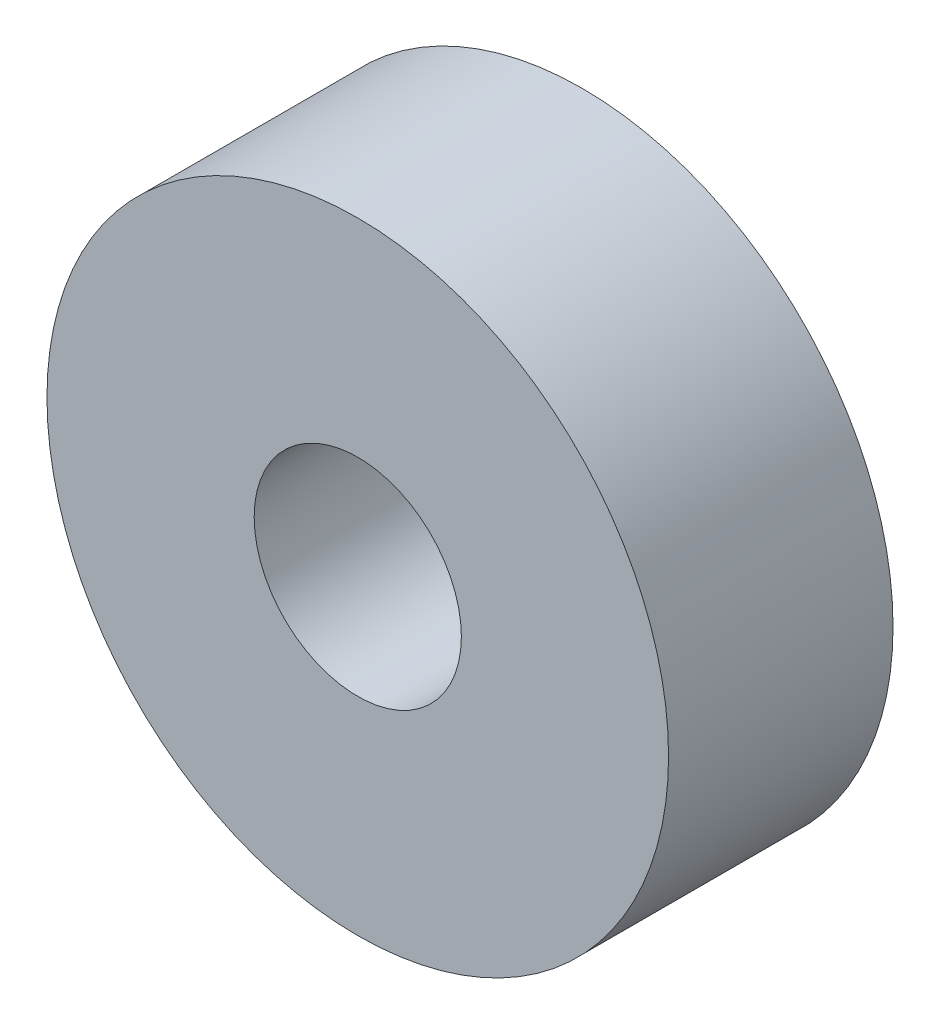
from build123d import *

# Parameters (mm, degrees)
SKETCH_1_R      = 9
SKETCH_1_R_2    = 3
EXTRUDE_2_DEPTH = 6.5


with BuildPart() as part:
    # Эскиз1 → Вытянуть2 (new body)
    with BuildSketch(Plane.XY):
        Circle(SKETCH_1_R)
        Circle(SKETCH_1_R_2, mode=Mode.SUBTRACT)
    extrude(amount=EXTRUDE_2_DEPTH)


solid = part.part
